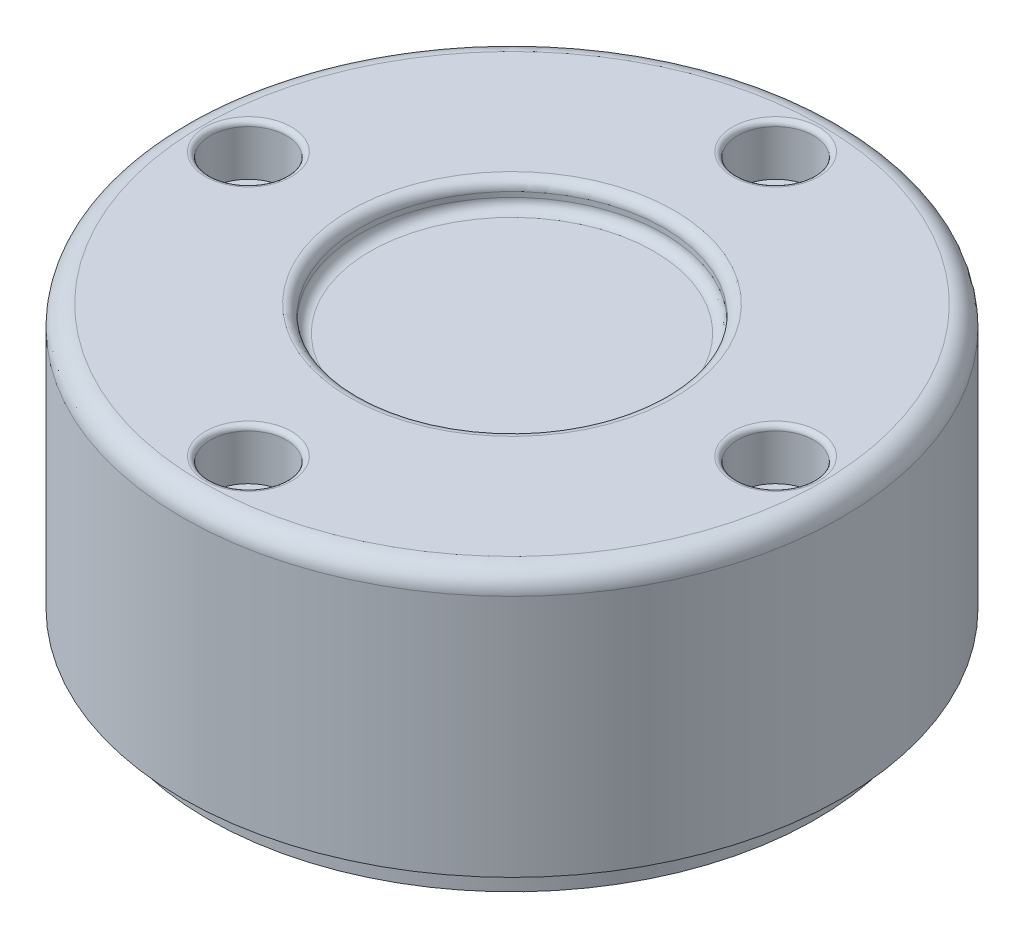
from build123d import *

# Parameters (mm, degrees)
SKETCH2_R           = 30
BOSS_EXTRUDE1_DEPTH = 3
SKETCH3_R           = 32.5
BOSS_EXTRUDE2_DEPTH = 26
SKETCH4_R           = 15
CUT_EXTRUDE1_DEPTH  = 2.5
SKETCH4_3_R         = 3.75
CUT_EXTRUDE2_DEPTH  = 5
FILLET1_R           = 1
FILLET2_R           = 1
FILLET3_R           = 2
FILLET4_R           = 0.5
SHELL1_OUTLINE_R    = 27.5
SHELL1_DEPTH        = 21.5
SHELL1_START        = 5.5
SHELL1_2_DEPTH      = 18.5
SHELL1_3_DEPTH      = 16
SHELL1_START_2      = 24
SHELL1_4_DEPTH      = 2.5
SHELL1_6_OUTLINE_R  = 17.354101966
SHELL1_6_DEPTH      = 2.5


with BuildPart() as part:
    # Sketch2 → Boss-Extrude1 (new body)
    with BuildSketch(Plane(origin=(0, 0, 0), x_dir=(1, 0, 0), z_dir=(0, 1, 0))):
        with Locations(Location((0, 0, 0), (0, 0, 270))):
            Circle(SKETCH2_R)
    extrude(amount=BOSS_EXTRUDE1_DEPTH)

    # Sketch3 → Boss-Extrude2 (add)
    with BuildSketch(Plane(origin=(0, 3, 0), x_dir=(1, 0, 0), z_dir=(0, 1, 0))):
        with Locations(Location((0, 0, 0), (0, 0, 90))):
            Circle(SKETCH3_R)
    extrude(amount=BOSS_EXTRUDE2_DEPTH)

    # Sketch4 → Cut-Extrude1 (cut)
    with BuildSketch(Plane(origin=(0, 29, 0), x_dir=(1, 0, 0), z_dir=(0, 1, 0))):
        with Locations(Location((0, 0, 0), (0, 0, 270))):
            Circle(SKETCH4_R)
    extrude(amount=-CUT_EXTRUDE1_DEPTH, mode=Mode.SUBTRACT)

    # Sketch4<3> → Cut-Extrude2 (cut)
    with BuildSketch(Plane(origin=(0, 29, 0), x_dir=(1, 0, 0), z_dir=(0, 1, 0))):
        with Locations(Location((0, 26, 0), (0, 0, 270))):
            Circle(SKETCH4_3_R)
        with Locations(Location((26, 0, 0), (0, 0, 270))):
            Circle(SKETCH4_3_R)
        with Locations(Location((0, -26, 0), (0, 0, 270))):
            Circle(SKETCH4_3_R)
        with Locations(Location((-26, 0, 0), (0, 0, 270))):
            Circle(SKETCH4_3_R)
    extrude(amount=-CUT_EXTRUDE2_DEPTH, mode=Mode.SUBTRACT)

    # Fillet1
    fillet1_edges = [part.edges().sort_by_distance(p)[0] for p in [
        (0, 26.5, -15),
    ]]
    fillet(fillet1_edges, radius=FILLET1_R)

    # Fillet2
    fillet2_edges = [part.edges().sort_by_distance(p)[0] for p in [
        (0, 29, -15),
    ]]
    fillet(fillet2_edges, radius=FILLET2_R)

    # Fillet3
    fillet3_edges = [part.edges().sort_by_distance(p)[0] for p in [
        (0, 29, 32.5),
    ]]
    fillet(fillet3_edges, radius=FILLET3_R)

    # Fillet4
    fillet4_edges = [part.edges().sort_by_distance(p)[0] for p in [
        (-26, 29, -3.75),
        (0, 29, -29.75),
        (26, 29, -3.75),
        (0, 29, 22.25),
    ]]
    fillet(fillet4_edges, radius=FILLET4_R)

    # Shell1: read off the stored shape, not the designer's step
    # Shell1 outline → Shell1 (cut)
    with BuildSketch(Plane(origin=(0, 0, 0), x_dir=(1, 0, 0), z_dir=(0, 1, 0))):
        Circle(SHELL1_OUTLINE_R)
    extrude(amount=SHELL1_DEPTH, mode=Mode.SUBTRACT)

    # Shell1 2 outline → Shell1 2 (cut)
    with BuildSketch(Plane(origin=(0, 0, 0), x_dir=(1, 0, 0), z_dir=(0, 1, 0)).offset(SHELL1_START)):
        with BuildLine():
            ThreePointArc((29.556490385, 5.139443175), (21.213203436, 21.213203436), (5.139443175, 29.556490385))
            ThreePointArc((5.139443175, 29.556490385), (0, 19.75), (-5.139443175, 29.556490385))
            ThreePointArc((-5.139443175, 29.556490385), (-21.213203436, 21.213203436), (-29.556490385, 5.139443175))
            ThreePointArc((-29.556490385, 5.139443175), (-19.75, 0), (-29.556490385, -5.139443175))
            ThreePointArc((-29.556490385, -5.139443175), (-21.213203436, -21.213203436), (-5.139443175, -29.556490385))
            ThreePointArc((-5.139443175, -29.556490385), (0, -19.75), (5.139443175, -29.556490385))
            ThreePointArc((5.139443175, -29.556490385), (21.213203436, -21.213203436), (29.556490385, -5.139443175))
            ThreePointArc((29.556490385, -5.139443175), (19.75, 0), (29.556490385, 5.139443175))
        make_face()
    extrude(amount=SHELL1_2_DEPTH, mode=Mode.SUBTRACT)

    # Shell1 3 outline → Shell1 3 (cut)
    with BuildSketch(Plane(origin=(0, 0, 0), x_dir=(1, 0, 0), z_dir=(0, 1, 0)).offset(SHELL1_START)):
        with BuildLine():
            ThreePointArc((29.556490385, -5.139443175), (30, 0), (29.556490385, 5.139443175))
            ThreePointArc((29.556490385, 5.139443175), (28.237962341, 5.835582624), (26.792067308, 6.199607196))
            ThreePointArc((26.792067308, 6.199607196), (27.5, 0), (26.792067308, -6.199607196))
            ThreePointArc((26.792067308, -6.199607196), (28.237962341, -5.835582624), (29.556490385, -5.139443175))
        make_face()
        with BuildLine():
            ThreePointArc((6.199607196, 26.792067308), (5.835582624, 28.237962341), (5.139443175, 29.556490385))
            ThreePointArc((5.139443175, 29.556490385), (0, 30), (-5.139443175, 29.556490385))
            ThreePointArc((-5.139443175, 29.556490385), (-5.835582624, 28.237962341), (-6.199607196, 26.792067308))
            ThreePointArc((-6.199607196, 26.792067308), (0, 27.5), (6.199607196, 26.792067308))
        make_face()
        with BuildLine():
            ThreePointArc((-5.139443175, -29.556490385), (0, -30), (5.139443175, -29.556490385))
            ThreePointArc((5.139443175, -29.556490385), (5.835582624, -28.237962341), (6.199607196, -26.792067308))
            ThreePointArc((6.199607196, -26.792067308), (0, -27.5), (-6.199607196, -26.792067308))
            ThreePointArc((-6.199607196, -26.792067308), (-5.835582624, -28.237962341), (-5.139443175, -29.556490385))
        make_face()
        with BuildLine():
            ThreePointArc((-26.792067308, 6.199607196), (-28.237962341, 5.835582624), (-29.556490385, 5.139443175))
            ThreePointArc((-29.556490385, 5.139443175), (-30, 0), (-29.556490385, -5.139443175))
            ThreePointArc((-29.556490385, -5.139443175), (-28.237962341, -5.835582624), (-26.792067308, -6.199607196))
            ThreePointArc((-26.792067308, -6.199607196), (-27.5, 0), (-26.792067308, 6.199607196))
        make_face()
    extrude(amount=SHELL1_3_DEPTH, mode=Mode.SUBTRACT)

    # Shell1 4 outline → Shell1 4 (cut)
    with BuildSketch(Plane(origin=(0, 0, 0), x_dir=(1, 0, 0), z_dir=(0, 1, 0)).offset(SHELL1_START_2)):
        with BuildLine():
            ThreePointArc((26.792067308, 6.199607196), (28.237962341, 5.835582624), (29.556490385, 5.139443175))
            ThreePointArc((29.556490385, 5.139443175), (21.213203436, 21.213203436), (5.139443175, 29.556490385))
            ThreePointArc((5.139443175, 29.556490385), (5.835582624, 28.237962341), (6.199607196, 26.792067308))
            ThreePointArc((6.199607196, 26.792067308), (19.445436483, 19.445436483), (26.792067308, 6.199607196))
        make_face()
        with BuildLine():
            ThreePointArc((5.139443175, -29.556490385), (21.213203436, -21.213203436), (29.556490385, -5.139443175))
            ThreePointArc((29.556490385, -5.139443175), (28.237962341, -5.835582624), (26.792067308, -6.199607196))
            ThreePointArc((26.792067308, -6.199607196), (19.445436483, -19.445436483), (6.199607196, -26.792067308))
            ThreePointArc((6.199607196, -26.792067308), (5.835582624, -28.237962341), (5.139443175, -29.556490385))
        make_face()
        with BuildLine():
            ThreePointArc((-6.199607196, 26.792067308), (-5.835582624, 28.237962341), (-5.139443175, 29.556490385))
            ThreePointArc((-5.139443175, 29.556490385), (-21.213203436, 21.213203436), (-29.556490385, 5.139443175))
            ThreePointArc((-29.556490385, 5.139443175), (-28.237962341, 5.835582624), (-26.792067308, 6.199607196))
            ThreePointArc((-26.792067308, 6.199607196), (-19.445436483, 19.445436483), (-6.199607196, 26.792067308))
        make_face()
        with BuildLine():
            ThreePointArc((-29.556490385, -5.139443175), (-21.213203436, -21.213203436), (-5.139443175, -29.556490385))
            ThreePointArc((-5.139443175, -29.556490385), (-5.835582624, -28.237962341), (-6.199607196, -26.792067308))
            ThreePointArc((-6.199607196, -26.792067308), (-19.445436483, -19.445436483), (-26.792067308, -6.199607196))
            ThreePointArc((-26.792067308, -6.199607196), (-28.237962341, -5.835582624), (-29.556490385, -5.139443175))
        make_face()
    extrude(amount=SHELL1_4_DEPTH, mode=Mode.SUBTRACT)

    # Shell1 5 outline → Shell1 5 (revolve, cut)
    with BuildSketch(Plane.XY):
        with BuildLine():
            ThreePointArc((17.354101966, 26.5), (16.091650066, 24.69375696), (14, 24))
            Line((14, 24), (17.354101966, 24))
            Line((17.354101966, 24), (17.354101966, 26.5))
        make_face()
    revolve(axis=Axis((0, 0, 0), (0, 1, 0)), mode=Mode.SUBTRACT)

    # Shell1 6 outline → Shell1 6 (cut)
    with BuildSketch(Plane(origin=(0, 0, 0), x_dir=(1, 0, 0), z_dir=(0, 1, 0)).offset(SHELL1_START_2)):
        with BuildLine():
            ThreePointArc((-26.792067308, 6.199607196), (-19.75, 0), (-26.792067308, -6.199607196))
            ThreePointArc((-26.792067308, -6.199607196), (-19.445436483, -19.445436483), (-6.199607196, -26.792067308))
            ThreePointArc((-6.199607196, -26.792067308), (0, -19.75), (6.199607196, -26.792067308))
            ThreePointArc((6.199607196, -26.792067308), (19.445436483, -19.445436483), (26.792067308, -6.199607196))
            ThreePointArc((26.792067308, -6.199607196), (19.75, 0), (26.792067308, 6.199607196))
            ThreePointArc((26.792067308, 6.199607196), (19.445436483, 19.445436483), (6.199607196, 26.792067308))
            ThreePointArc((6.199607196, 26.792067308), (0, 19.75), (-6.199607196, 26.792067308))
            ThreePointArc((-6.199607196, 26.792067308), (-19.445436483, 19.445436483), (-26.792067308, 6.199607196))
        make_face()
        Circle(SHELL1_6_OUTLINE_R, mode=Mode.SUBTRACT)
    extrude(amount=SHELL1_6_DEPTH, mode=Mode.SUBTRACT)


solid = part.part
